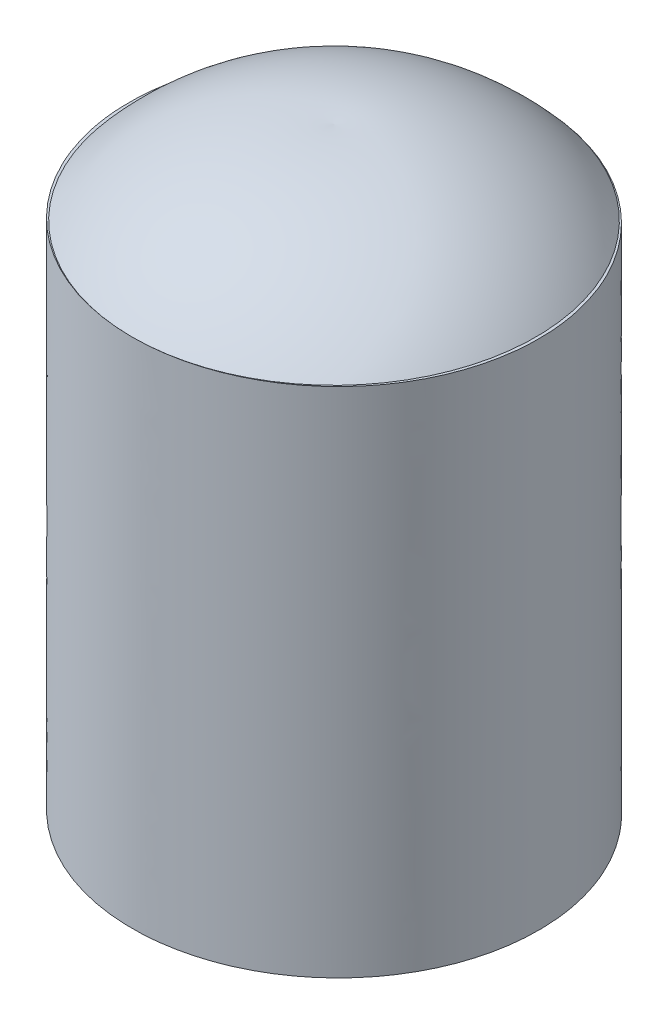
from build123d import *

# Parameters (mm, degrees)
SKETCH1_RX         = 8
SKETCH1_RY         = 7.72
CUT_EXTRUDE1_DEPTH = 61


with BuildPart() as part:
    # Loft2: read off the stored shape, not the designer's step
    # Loft2: loft between two sections, ruled curve by curve
    loft2_from = [
        Edge.make_bspline([(-9.688099795, 0, 0.005998499), (-9.700274222, 0, -19.087814103), (9.675925368, 0, -19.099811101), (9.688099795, 0, -0.005998499), (9.700274222, 0, 19.087814103), (-9.675925368, 0, 19.099811101), (-9.688099795, 0, 0.005998499)], [0, 0, 0, 0, 0.5, 0.5, 0.5, 1, 1, 1, 1], 3, [1, 0.333333333, 0.333333333, 1, 0.333333333, 0.333333333, 1]),
    ]
    loft2_to = [
        Edge.make_bspline([(-9.680986707, -24.231, 0.365818879), (-10.423444986, -24.231, -18.713974877), (8.938528428, -24.231, -19.445612636), (9.680986707, -24.231, -0.365818879), (10.423444986, -24.231, 18.713974877), (-8.938528428, -24.231, 19.445612636), (-9.680986707, -24.231, 0.365818879)], [0, 0, 0, 0, 0.5, 0.5, 0.5, 1, 1, 1, 1], 3, [1, 0.333333333, 0.333333333, 1, 0.333333333, 0.333333333, 1]),
    ]
    loft2 = Solid(Shell([*[Face.make_surface_from_curves(loft2_from[k], loft2_to[k]) for k in range(1)], Face(Wire(loft2_from)), Face(Wire(loft2_to))]))
    add(loft2)

    # Sketch1 → Cut-Extrude1 (cut)
    with BuildSketch(Plane(origin=(0, 0, 0), x_dir=(1, 0, 0), z_dir=(0, 1, 0))):
        with Locations(Location((0, 0), (0, 0, 180))):
            Ellipse(SKETCH1_RX, SKETCH1_RY)
    extrude(amount=-CUT_EXTRUDE1_DEPTH, mode=Mode.SUBTRACT)

    # Sketch7 → Revolve1 (revolve)
    with BuildSketch(Plane(origin=(0, 0, 0), x_dir=(0, 0, -1), z_dir=(1, 0, 0))):
        with BuildLine():
            Line((0, 3.954458849), (0, 0))
            Line((0, 0), (9.546908185, 0))
            ThreePointArc((9.546908185, 0), (5.239055183, 3.101289891), (0, 3.954458849))
        make_face()
    revolve(axis=Axis((0, 0, 0), (0, -1, 0)))


solid = part.part
